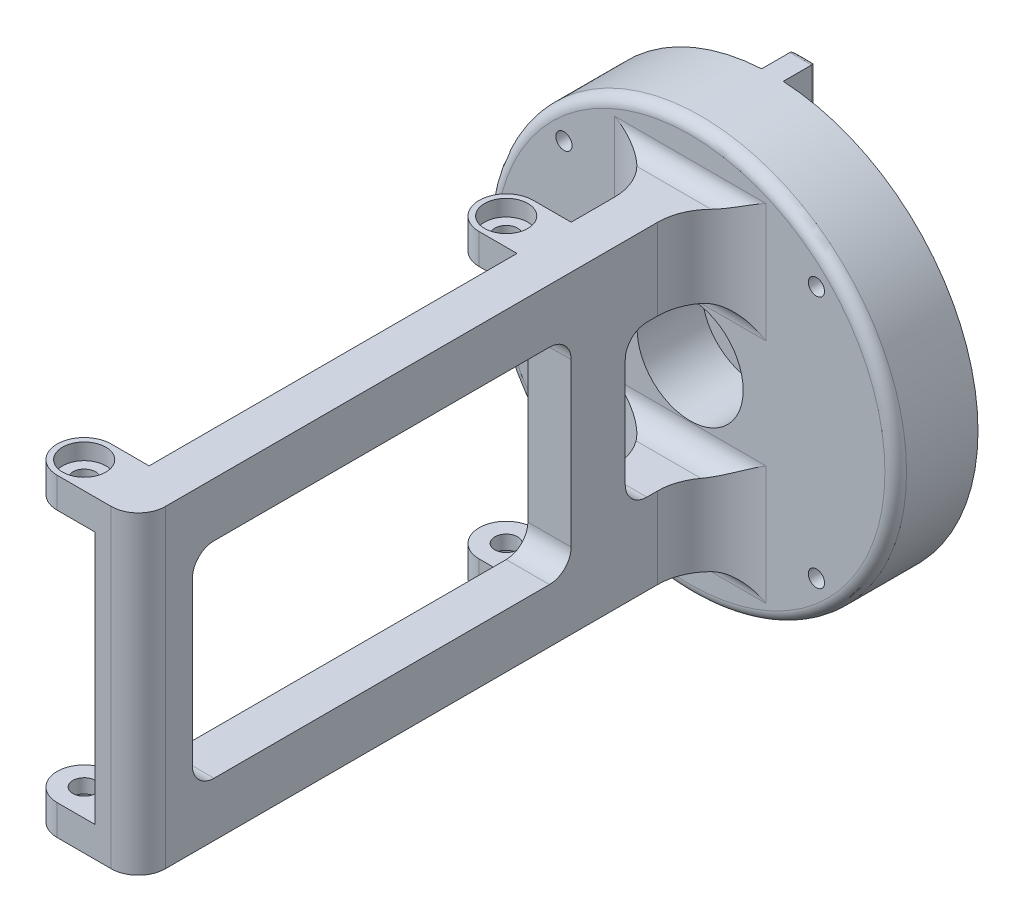
from build123d import *

# Parameters (mm, degrees)
SKETCH1_R           = 19
SKETCH1_R_2         = 1
BOSS_EXTRUDE1_DEPTH = 1.6
SKETCH2_R           = 19
SKETCH2_R_2         = 0.75
BOSS_EXTRUDE2_DEPTH = 6
SKETCH8_R           = 12.75
CUT_EXTRUDE4_DEPTH  = 1
SKETCH3_R           = 4.9
CUT_EXTRUDE1_DEPTH  = 6
BOSS_EXTRUDE3_DEPTH = 2
FILLET1_R           = 5
FILLET2_R           = 2
SKETCH5_W           = 5
SKETCH5_H           = 2.8
BOSS_EXTRUDE4_DEPTH = 6
SKETCH6_R           = 1.05
CUT_EXTRUDE2_DEPTH  = 72.802576555
SKETCH7_R           = 2
CUT_EXTRUDE3_DEPTH  = 1.5
FILLET3_R           = 2.5
FILLET4_R           = 2.5
FILLET5_R           = 1.5
FILLET6_R           = 2
BOSS_EXTRUDE5_START = 3
BOSS_EXTRUDE5_DEPTH = 3
FILLET8_R           = 1
SKETCH10_W          = 35
SKETCH10_H          = 19
CUT_EXTRUDE5_DEPTH  = 67.890657074
FILLET9_R           = 2
FILLET10_R          = 0.4


with BuildPart() as part:
    # Sketch1 → Boss-Extrude1 (new body)
    with BuildSketch(Plane.XY):
        Circle(SKETCH1_R)
        with Locations((-11.66726189, 11.66726189)):
            Circle(SKETCH1_R_2, mode=Mode.SUBTRACT)
        with Locations((11.66726189, 11.66726189)):
            Circle(SKETCH1_R_2, mode=Mode.SUBTRACT)
        with Locations((11.66726189, -11.66726189)):
            Circle(SKETCH1_R_2, mode=Mode.SUBTRACT)
        with Locations((-11.66726189, -11.66726189)):
            Circle(SKETCH1_R_2, mode=Mode.SUBTRACT)
    extrude(amount=BOSS_EXTRUDE1_DEPTH)

    # Sketch2 → Boss-Extrude2 (add)
    with BuildSketch(Plane.XY.offset(1.6)):
        Circle(SKETCH2_R)
        with Locations((-11.66726189, -11.66726189)):
            Circle(SKETCH2_R_2, mode=Mode.SUBTRACT)
        with Locations((-11.66726189, 11.66726189)):
            Circle(SKETCH2_R_2, mode=Mode.SUBTRACT)
        with Locations((11.66726189, 11.66726189)):
            Circle(SKETCH2_R_2, mode=Mode.SUBTRACT)
        with Locations((11.66726189, -11.66726189)):
            Circle(SKETCH2_R_2, mode=Mode.SUBTRACT)
    extrude(amount=BOSS_EXTRUDE2_DEPTH)

    # Sketch8 → Cut-Extrude4 (cut)
    with BuildSketch(Plane(origin=(0, 0, 0), x_dir=(-1, 0, 0), z_dir=(0, 0, -1))):
        Circle(SKETCH8_R)
    extrude(amount=-CUT_EXTRUDE4_DEPTH, mode=Mode.SUBTRACT)

    # Sketch3 → Cut-Extrude1 (cut)
    with BuildSketch(Plane.XY.offset(7.6)):
        Circle(SKETCH3_R)
    extrude(amount=-CUT_EXTRUDE1_DEPTH, mode=Mode.SUBTRACT)

    # Sketch4 → Boss-Extrude3 (add, symmetric)
    with BuildSketch(Plane(origin=(0, 0, 0), x_dir=(0, 0, -1), z_dir=(1, 0, 0))):
        Polygon((-7.6, 14.5), (-60.6, 14.5), (-60.6, -14.5), (-7.6, -14.5), (-7.6, -7), (-15.6, -7), (-15.6, 7), (-7.6, 7), align=None)
    extrude(amount=BOSS_EXTRUDE3_DEPTH, both=True)

    # Fillet1
    fillet1_edges = [part.edges().sort_by_distance(p)[0] for p in [
        (-2, 10.75, 7.6),
        (-2, -10.75, 7.6),
        (2, 10.75, 7.6),
        (2, -10.75, 7.6),
    ]]
    fillet(fillet1_edges, radius=FILLET1_R)

    # Fillet2
    fillet2_edges = [part.edges().sort_by_distance(p)[0] for p in [
        (0, -7, 15.6),
        (0, 7, 15.6),
    ]]
    fillet(fillet2_edges, radius=FILLET2_R)

    # Sketch5 → Boss-Extrude4 (add)
    with BuildSketch(Plane(origin=(-2, 14.5, 12.6), x_dir=(0, 0, -1), z_dir=(1, 0, 0))):
        with Locations((-45.5, -1.4)):
            Rectangle(SKETCH5_W, SKETCH5_H)
        with Locations((-6.5, -1.4)):
            Rectangle(SKETCH5_W, SKETCH5_H)
        with Locations((-6.5, -27.6)):
            Rectangle(SKETCH5_W, SKETCH5_H)
        with Locations((-45.5, -27.6)):
            Rectangle(SKETCH5_W, SKETCH5_H)
    extrude(amount=-BOSS_EXTRUDE4_DEPTH)

    # Sketch6 → Cut-Extrude2 (cut, through all)
    with BuildSketch(Plane(origin=(0, 14.5, 0), x_dir=(1, 0, 0), z_dir=(0, 1, 0))):
        with Locations(Location((-5.5, -58.1, 0), (0, 0, 270))):
            Circle(SKETCH6_R)
        with Locations(Location((-5.5, -19.1, 0), (0, 0, 270))):
            Circle(SKETCH6_R)
    extrude(amount=-CUT_EXTRUDE2_DEPTH, mode=Mode.SUBTRACT)

    # Sketch7 → Cut-Extrude3 (cut)
    with BuildSketch(Plane(origin=(0, 14.5, 0), x_dir=(1, 0, 0), z_dir=(0, 1, 0))):
        with Locations(Location((-5.5, -19.1, 0), (0, 0, 270))):
            Circle(SKETCH7_R)
        with Locations(Location((-5.5, -58.1, 0), (0, 0, 270))):
            Circle(SKETCH7_R)
    cut_extrude3 = extrude(amount=-CUT_EXTRUDE3_DEPTH, mode=Mode.SUBTRACT)

    # Mirror1: Cut-Extrude3 across plane
    add(cut_extrude3.mirror(Plane.ZX), mode=Mode.SUBTRACT)

    # Fillet3
    fillet3_edges = [part.edges().sort_by_distance(p)[0] for p in [
        (-8, -13.1, 60.6),
        (-8, -13.1, 55.6),
        (-8, 13.1, 60.6),
        (-8, 13.1, 55.6),
        (-8, -13.1, 21.6),
        (-8, -13.1, 16.6),
        (-8, 13.1, 21.6),
        (-8, 13.1, 16.6),
    ]]
    fillet(fillet3_edges, radius=FILLET3_R - 0.0001)  # a hair under: the kernel refuses the full size

    # Fillet4
    fillet4_edges = [part.edges().sort_by_distance(p)[0] for p in [
        (2, 0, 60.6),
    ]]
    fillet(fillet4_edges, radius=FILLET4_R)

    # Fillet5
    fillet5_edges = [part.edges().sort_by_distance(p)[0] for p in [
        (0, 14.5, 7.6),
        (0, -14.5, 7.6),
    ]]
    fillet(fillet5_edges, radius=FILLET5_R)

    # Fillet6
    fillet6_edges = [part.edges().sort_by_distance(p)[0] for p in [
        (0, 7, 7.6),
        (0, -7, 7.6),
    ]]
    fillet(fillet6_edges, radius=FILLET6_R)

    # Sketch9 → Boss-Extrude5 (add)
    with BuildSketch(Plane(origin=(0, 0, 0), x_dir=(-1, 0, 0), z_dir=(0, 0, -1)).offset(BOSS_EXTRUDE5_START)):
        with BuildLine():
            Line((-1, 18.973665961), (-1, 14.973665961))
            Line((-1, 14.973665961), (1, 14.973665961))
            Line((1, 14.973665961), (1, 18.973665961))
            ThreePointArc((1, 18.973665961), (0, 19), (-1, 18.973665961))
        make_face()
    extrude(amount=-BOSS_EXTRUDE5_DEPTH)

    # Fillet8
    fillet8_edges = [part.edges().sort_by_distance(p)[0] for p in [
        (-19, 0, 7.6),
    ]]
    fillet(fillet8_edges, radius=FILLET8_R)

    # Sketch10 → Cut-Extrude5 (cut, through all)
    with BuildSketch(Plane.ZY.offset(2)):
        with Locations((38.1, 0)):
            Rectangle(SKETCH10_W, SKETCH10_H)
    extrude(amount=-CUT_EXTRUDE5_DEPTH, mode=Mode.SUBTRACT)

    # Fillet9
    fillet9_edges = [part.edges().sort_by_distance(p)[0] for p in [
        (0, 9.5, 20.6),
        (0, 9.5, 55.6),
        (0, -9.5, 55.6),
        (0, -9.5, 20.6),
    ]]
    fillet(fillet9_edges, radius=FILLET9_R)

    # Fillet10
    fillet10_edges = [part.edges().sort_by_distance(p)[0] for p in [
        (1, 16.973665961, -3),
        (0, 14.973665961, -3),
        (-1, 16.973665961, -3),
        (0, 19, -3),
    ]]
    fillet(fillet10_edges, radius=FILLET10_R)


solid = part.part
